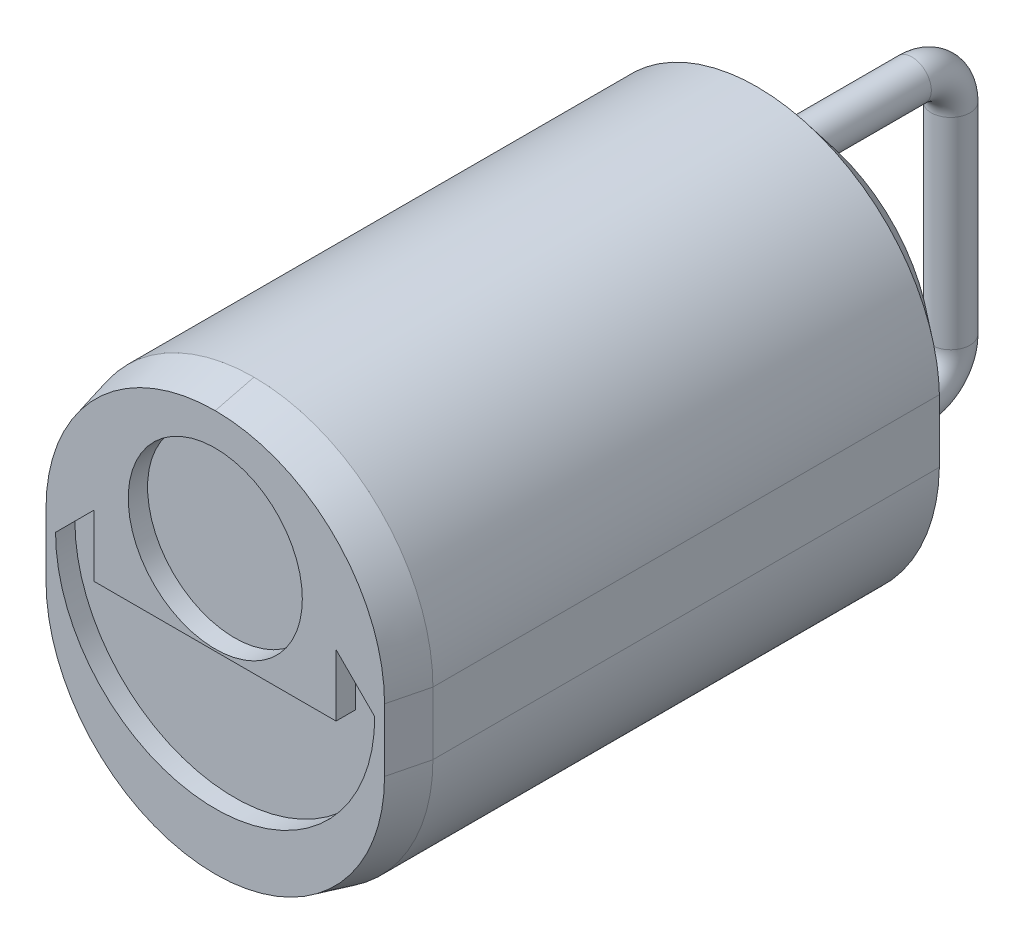
from build123d import *

# Parameters (mm, degrees)
BOSS_EXTRUDE1_DEPTH = 190.5
SKETCH6_R           = 6.35
SKETCH8_R           = 28.575
CUT_EXTRUDE1_DEPTH  = 6.35


with BuildPart() as part:
    # Sketch1 → Boss-Extrude1 (new body)
    with BuildSketch(Plane.XY):
        with BuildLine():
            Line((-58.7375, -10.31875), (-58.7375, 10.31875))
            ThreePointArc((-58.7375, 10.31875), (0, 69.05625), (58.7375, 10.31875))
            Line((58.7375, 10.31875), (58.7375, -10.31875))
            ThreePointArc((58.7375, -10.31875), (0, -69.05625), (-58.7375, -10.31875))
        make_face()
    extrude(amount=BOSS_EXTRUDE1_DEPTH)

    # Cut-Sweep1: sweep along a path in Sketch2
    with BuildLine(Plane(origin=(0, 0, 0), x_dir=(-1, 0, 0), z_dir=(0, 0, -1))) as cut_sweep1_path:
        Line((-44.45, -8.89), (-44.45, 8.89))
        ThreePointArc((-44.45, 8.89), (0, 53.34), (44.45, 8.89))
        Line((44.45, 8.89), (44.45, -8.89))
        ThreePointArc((44.45, -8.89), (0, -53.34), (-44.45, -8.89))
    # Sketch3 → Cut-Sweep1 (sweep, cut)
    with BuildSketch(Plane(origin=(0, 0, 0), x_dir=(0, 0, -1), z_dir=(1, 0, 0))):
        Polygon((-25.127096032, 84.43478134), (11.648649354, 38.924796424), (23.103545289, 84.43478134), align=None)
    sweep(path=cut_sweep1_path.line, mode=Mode.SUBTRACT)

    # Cut-Sweep2: sweep along a path in Sketch4
    with BuildLine(Plane.XY.offset(190.5)) as cut_sweep2_path:
        Line((-55.5625, -10.31875), (-55.5625, 10.31875))
        ThreePointArc((-55.5625, 10.31875), (0, 65.88125), (55.5625, 10.31875))
        Line((55.5625, 10.31875), (55.5625, -10.31875))
        ThreePointArc((55.5625, -10.31875), (0, -65.88125), (-55.5625, -10.31875))
    # Sketch5 → Cut-Sweep2 (sweep, cut)
    with BuildSketch(Plane(origin=(0, 0, 0), x_dir=(0, 0, -1), z_dir=(1, 0, 0))):
        Polygon((-190.5, 65.88125), (-177.8, 69.05625), (-190.5, 69.05625), align=None)
    sweep(path=cut_sweep2_path.line, mode=Mode.SUBTRACT)

    # Sweep1: sweep along a path in Sketch7
    with BuildLine(Plane(origin=(0, 0, 0), x_dir=(0, 0, -1), z_dir=(1, 0, 0))) as sweep1_path:
        Line((0, 45.72), (38.185995373, 45.72))
        ThreePointArc((38.185995373, 45.72), (47.166251494, 42.000256121), (50.885995373, 33.02))
        Line((50.885995373, 33.02), (50.885995373, -33.02))
        ThreePointArc((50.885995373, -33.02), (47.166251494, -42.000256121), (38.185995373, -45.72))
        Line((38.185995373, -45.72), (0, -45.72))
    # Sketch6 → Sweep1 (sweep)
    with BuildSketch(Plane(origin=(0, 0, 0), x_dir=(-1, 0, 0), z_dir=(0, 0, -1))):
        with Locations((0, 45.72)):
            Circle(SKETCH6_R)
    sweep(path=sweep1_path.line)

    # Sketch8 → Cut-Extrude1 (cut)
    with BuildSketch(Plane.XY.offset(190.5)):
        with Locations((0, 26.67)):
            Circle(SKETCH8_R)
        with BuildLine():
            Line((39.644162844, -2.54), (-39.730837156, -2.54))
            Line((-39.730837156, -2.54), (-39.730837156, 17.78))
            Line((-39.730837156, 17.78), (-52.430837156, 5.08))
            ThreePointArc((-52.430837156, 5.08), (-0.043337156, -47.3075), (52.344162844, 5.08))
            Line((52.344162844, 5.08), (39.644162844, 17.78))
            Line((39.644162844, 17.78), (39.644162844, -2.54))
        make_face()
    extrude(amount=-CUT_EXTRUDE1_DEPTH, mode=Mode.SUBTRACT)


solid = part.part
